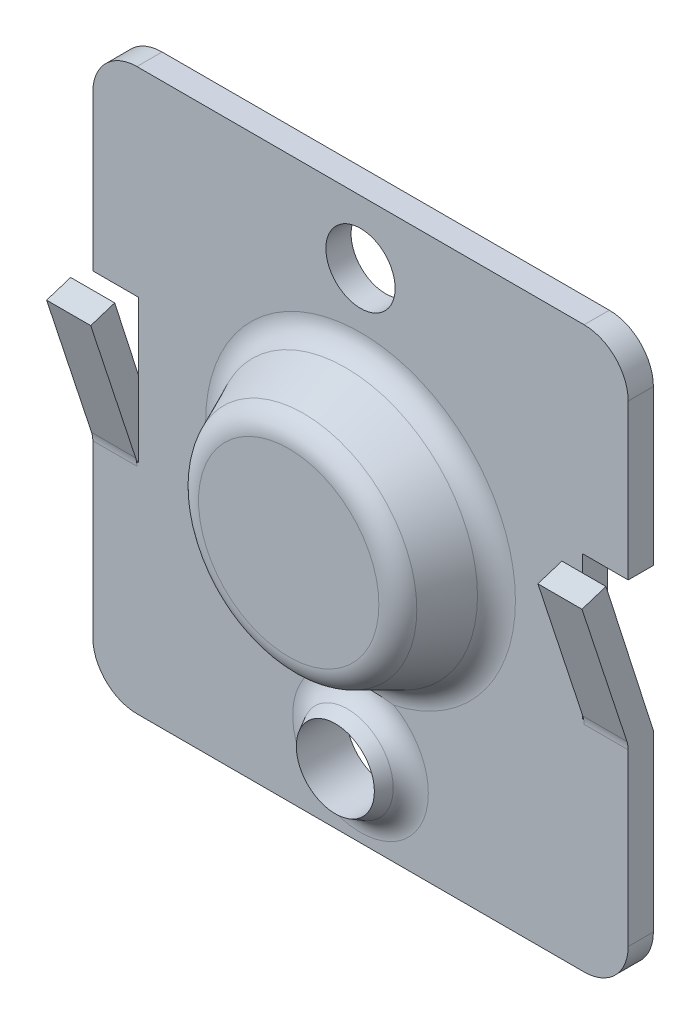
from build123d import *

# Parameters (mm, degrees)
SKETCH1_R           = 0.6985
SKETCH1_R_2         = 0.7874
BOSS_EXTRUDE1_DEPTH = 0.508
SKETCH3_R           = 2.794
SKETCH4_R           = 2.147566379
SKETCH5_R           = 1.067023976
SKETCH6_R           = 0.7874
CUT_EXTRUDE1_START  = -0.508
SKETCH7_R           = 0.7874
CUT_EXTRUDE1_DEPTH  = 0.508
BOSS_EXTRUDE2_DEPTH = 0.889
BOSS_EXTRUDE3_DEPTH = 0.889
FILLET1_R           = 0.508


with BuildPart() as part:
    # Sketch1 → Boss-Extrude1 (new body)
    with BuildSketch(Plane.XY):
        with BuildLine():
            Line((0.889, 0), (9.906, 0))
            ThreePointArc((9.906, 0), (10.534617928, 0.260382072), (10.795, 0.889))
            Line((10.795, 0.889), (10.795, 4.405000935))
            Line((10.795, 4.405000935), (9.871541288, 4.405000935))
            Line((9.871541288, 4.405000935), (9.871541288, 7.2898))
            Line((9.871541288, 7.2898), (10.795, 7.2898))
            Line((10.795, 7.2898), (10.795, 10.414))
            ThreePointArc((10.795, 10.414), (10.534617928, 11.042617928), (9.906, 11.303))
            Line((9.906, 11.303), (0.889, 11.303))
            ThreePointArc((0.889, 11.303), (0.260382072, 11.042617928), (0, 10.414))
            Line((0, 10.414), (0, 7.2898))
            Line((0, 7.2898), (0.923458712, 7.2898))
            Line((0.923458712, 7.2898), (0.923458712, 4.405000935))
            Line((0.923458712, 4.405000935), (0, 4.405000935))
            Line((0, 4.405000935), (0, 0.889))
            ThreePointArc((0, 0.889), (0.260382072, 0.260382072), (0.889, 0))
        make_face()
        with Locations((5.3975, 10.033)):
            Circle(SKETCH1_R, mode=Mode.SUBTRACT)
        with Locations((5.3975, 1.5494)):
            Circle(SKETCH1_R_2, mode=Mode.SUBTRACT)
    extrude(amount=BOSS_EXTRUDE1_DEPTH)

    # Sketch3 → Loft1 section 0
    with BuildSketch(Plane.XY.offset(0.508)):
        with Locations((5.3975, 5.7912)):
            Circle(SKETCH3_R)
    # Sketch4 → Loft1 section 1
    with BuildSketch(Plane.XY.offset(1.9558)):
        with Locations((5.3975, 5.7912)):
            Circle(SKETCH4_R)
    loft()

    # Sketch5 → Loft2 section 0
    with BuildSketch(Plane.XY.offset(0.508)):
        with Locations((5.3975, 1.5494)):
            Circle(SKETCH5_R)
    # Sketch6 → Loft2 section 1
    with BuildSketch(Plane.XY.offset(1.016)):
        with Locations((5.3975, 1.5494)):
            Circle(SKETCH6_R)
    loft()

    # Sketch7 → Cut-Extrude1 (cut)
    with BuildSketch(Plane.XY.offset(1.016).offset(CUT_EXTRUDE1_START)):
        with Locations((5.3975, 1.5494)):
            Circle(SKETCH7_R)
    extrude(amount=CUT_EXTRUDE1_DEPTH, mode=Mode.SUBTRACT)

    # Sketch9 → Boss-Extrude2 (add)
    with BuildSketch(Plane.ZY):
        Polygon((0, 4.405000935), (0.956058861, 7.4), (1.44, 7.245517076), (0.508, 4.405000935), align=None)
    extrude(amount=-BOSS_EXTRUDE2_DEPTH)

    # Sketch10 → Boss-Extrude3 (add)
    with BuildSketch(Plane(origin=(10.795, 0, 0), x_dir=(0, 0, -1), z_dir=(1, 0, 0))):
        Polygon((-1.44, 7.245517076), (-0.508, 4.405000935), (0, 4.405000935), (-0.956058861, 7.4), align=None)
    extrude(amount=-BOSS_EXTRUDE3_DEPTH)

    # Fillet1
    # the kernel refuses this fillet: 0.508 mm, written as the material it adds along each edge
    with BuildSketch(Plane(origin=(10.795, 4.405000935, 0.508), x_dir=(0, -1, 0), z_dir=(-1, 0, 0)), Plane(origin=(0.889, 4.405000935, 0.508), x_dir=(0, -1, 0), z_dir=(-1, 0, 0))) as fillet1_piece_1:
        with BuildLine():
            CenterArc((FILLET1_R * 0.159862126559, FILLET1_R), FILLET1_R, 251.83485126, 18.16514874)
            Line((-FILLET1_R * 0.151894895434, FILLET1_R * 0.0498381405053), (0, 0))
            Line((0, 0), (FILLET1_R * 0.159862126559, 0))
        make_face()
    extrude(amount=0.889)
    with BuildSketch(Plane(origin=(5.3975, 5.7912, 0.508), x_dir=(1, 0, 0), z_dir=(0, -1, 0))) as fillet1_piece_2:
        with BuildLine():
            CenterArc((2.794 + FILLET1_R * 0.648657698793, FILLET1_R), FILLET1_R, 204.060462248, 65.939537752)
            Line((2.794 - FILLET1_R * 0.264458035208, FILLET1_R * 0.592299550749), (2.794, 0))
            Line((2.794, 0), (2.794 + FILLET1_R * 0.648657698793, 0))
        make_face()
    revolve(axis=Axis((5.3975, 5.7912, 0.508), (0, 0, 1)))
    with BuildSketch(Plane(origin=(5.3975, 1.5494, 0.508), x_dir=(1, 0, 0), z_dir=(0, -1, 0))) as fillet1_piece_3:
        with BuildLine():
            CenterArc((1.067023976 + FILLET1_R * 0.591042865148, FILLET1_R), FILLET1_R, 208.830184855, 61.169815145)
            Line((1.067023976 - FILLET1_R * 0.285009893371, FILLET1_R * 0.517784732415), (1.067023976, 0))
            Line((1.067023976, 0), (1.067023976 + FILLET1_R * 0.591042865148, 0))
        make_face()
    revolve(axis=Axis((5.3975, 1.5494, 0.508), (0, 0, 1)))
    # the kernel refuses this fillet: 0.508 mm, written as the material it takes off along each edge
    with BuildSketch(Plane(origin=(5.3975, 5.7912, 1.9558), x_dir=(1, 0, 0), z_dir=(0, -1, 0))) as fillet1_2_piece_1:
        with BuildLine():
            CenterArc((2.147566379 - FILLET1_R * 0.648657698793, -FILLET1_R), FILLET1_R, 24.060462248, 65.939537752)
            Line((2.147566379 - FILLET1_R * 0.648657698793, 0), (2.147566379, 0))
            Line((2.147566379, 0), (2.147566379 + FILLET1_R * 0.264458035208, -FILLET1_R * 0.592299550749))
        make_face()
    revolve(axis=Axis((5.3975, 5.7912, 1.9558), (0, 0, 1)), mode=Mode.SUBTRACT)


solid = part.part
